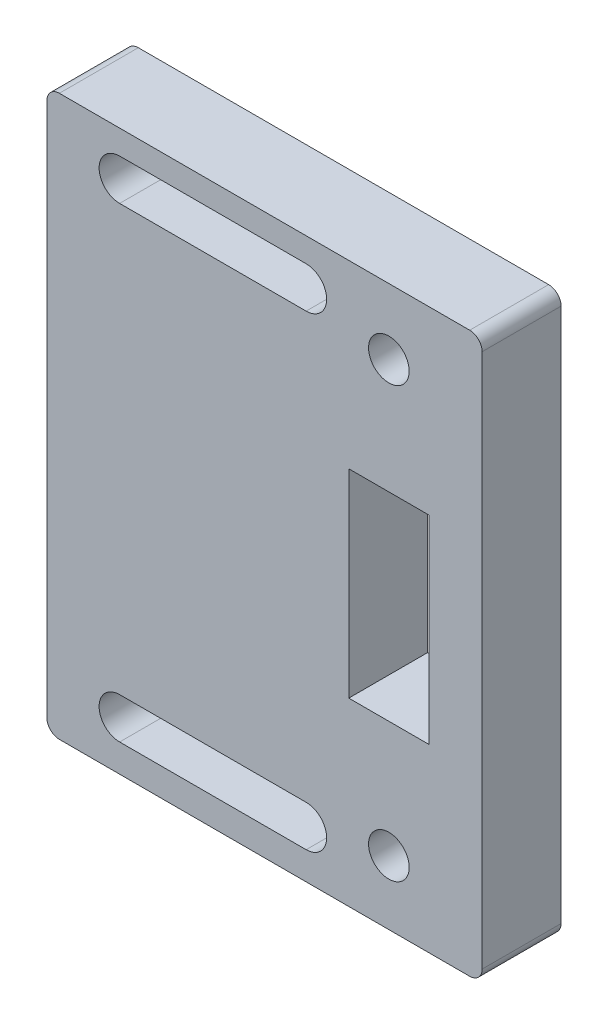
from build123d import *

# Parameters (mm, degrees)
SKETCH1_W                                        = 70
SKETCH1_H                                        = 90
BOSS_EXTRUDE1_DEPTH                              = 12.7
CSK_FOR_1_4_FLAT_HEAD_MACHINE_SCREW1_D           = 6.5278
CSK_FOR_1_4_FLAT_HEAD_MACHINE_SCREW1_CSINK_D     = 12.8778
CSK_FOR_1_4_FLAT_HEAD_MACHINE_SCREW1_CSINK_ANGLE = 82
FILLET1_R                                        = 2
CUT_EXTRUDE1_DEPTH                               = 115.72266559


with BuildPart() as part:
    # Sketch1 → Boss-Extrude1 (new body)
    with BuildSketch(Plane.XY):
        with Locations((35, -45)):
            Rectangle(SKETCH1_W, SKETCH1_H)
        Polygon((55, -29.025), (61.45, -29.025), (61.45, -60.975), (55, -60.975), (48.55, -60.975), (48.55, -29.025), align=None, mode=Mode.SUBTRACT)
    extrude(amount=BOSS_EXTRUDE1_DEPTH)

    # CSK for 1/4 Flat Head Machine Screw1 (through all)
    with Locations(Plane(origin=(0, 0, 0), x_dir=(-1, 0, 0), z_dir=(0, 0, -1))):
        with Locations((-55, -10.579610023), (-55, -79.699610023)):
            CounterSinkHole(CSK_FOR_1_4_FLAT_HEAD_MACHINE_SCREW1_D / 2, CSK_FOR_1_4_FLAT_HEAD_MACHINE_SCREW1_CSINK_D / 2, counter_sink_angle=CSK_FOR_1_4_FLAT_HEAD_MACHINE_SCREW1_CSINK_ANGLE)

    # Fillet1
    fillet1_edges = [part.edges().sort_by_distance(p)[0] for p in [
        (0, 0, 6.35),
        (70, 0, 6.35),
        (0, -90, 6.35),
        (70, -90, 6.35),
    ]]
    fillet(fillet1_edges, radius=FILLET1_R)

    # Sketch7 → Cut-Extrude1 (cut, through all)
    with BuildSketch(Plane(origin=(0, 0, 0), x_dir=(-1, 0, 0), z_dir=(0, 0, -1))):
        with BuildLine():
            Line((-41.695527842, -85.513384119), (-11.695527842, -85.513384119))
            ThreePointArc((-11.695527842, -85.513384119), (-8.395527842, -82.213384119), (-11.695527842, -78.913384119))
            Line((-11.695527842, -78.913384119), (-41.695527842, -78.913384119))
            ThreePointArc((-41.695527842, -78.913384119), (-44.995527842, -82.213384119), (-41.695527842, -85.513384119))
        make_face()
        with BuildLine():
            Line((-11.695527842, -10.493384119), (-41.695527842, -10.493384119))
            ThreePointArc((-41.695527842, -10.493384119), (-44.995527842, -7.193384119), (-41.695527842, -3.893384119))
            Line((-41.695527842, -3.893384119), (-11.695527842, -3.893384119))
            ThreePointArc((-11.695527842, -3.893384119), (-8.395527842, -7.193384119), (-11.695527842, -10.493384119))
        make_face()
    extrude(amount=-CUT_EXTRUDE1_DEPTH, mode=Mode.SUBTRACT)


solid = part.part
